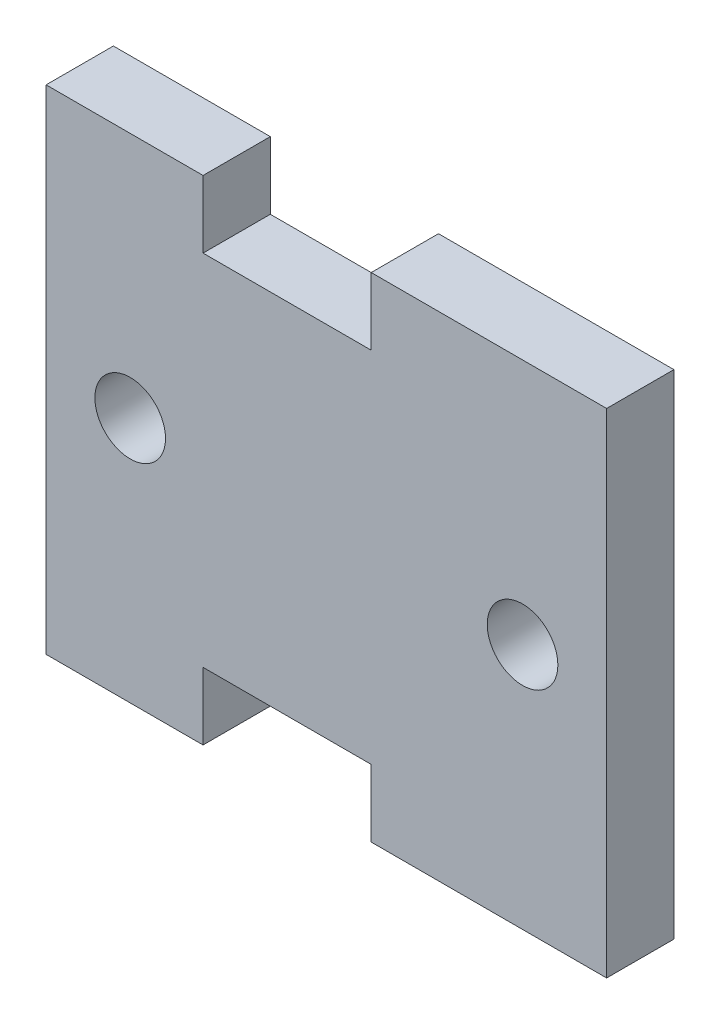
from build123d import *

# Parameters (mm, degrees)
ESBO_O1_R                = 3.15
RESSALTO_EXTRUS_O1_DEPTH = 6


with BuildPart() as part:
    # Esboço1 → Ressalto-extrusão1 (new body)
    with BuildSketch(Plane.XY):
        Polygon((-25, 22), (-25, -22), (-11, -22), (-11, -16), (4, -16), (4, -22), (25, -22), (25, 22), (4, 22), (4, 16), (-11, 16), (-11, 22), align=None)
        with Locations((-17.5, 0)):
            Circle(ESBO_O1_R, mode=Mode.SUBTRACT)
        with Locations((17.5, 0)):
            Circle(ESBO_O1_R, mode=Mode.SUBTRACT)
    extrude(amount=RESSALTO_EXTRUS_O1_DEPTH)


solid = part.part
